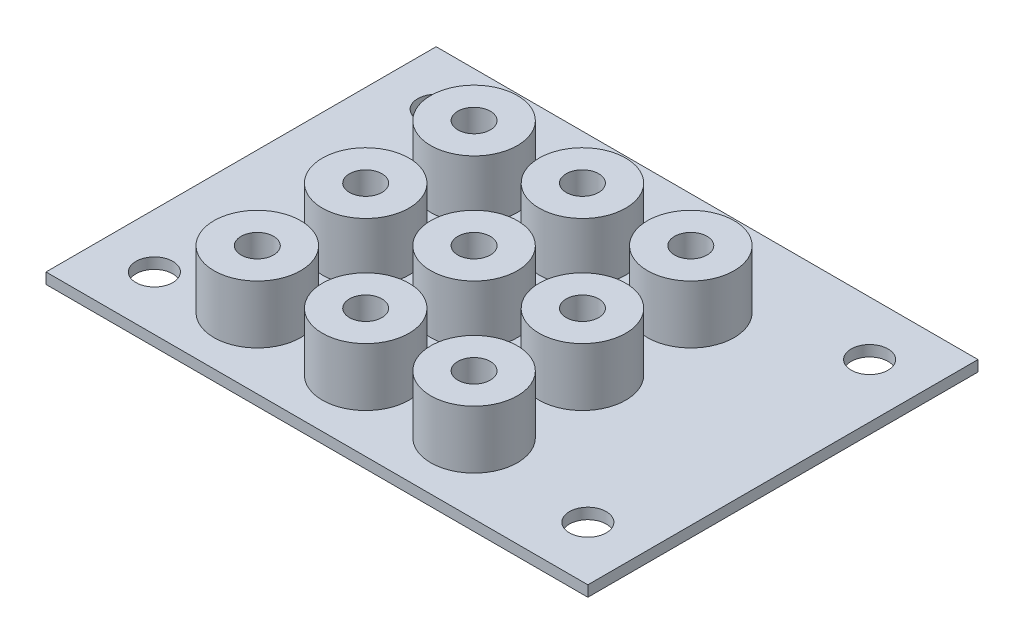
from build123d import *

# Parameters (mm, degrees)
SKETCH1_W           = 50
SKETCH1_H           = 36
SKETCH1_R           = 1.7
SKETCH1_R_2         = 1.25
BOSS_EXTRUDE1_DEPTH = 1
SKETCH2_R           = 4
SKETCH2_R_2         = 1.5
BOSS_EXTRUDE2_DEPTH = 5.35


with BuildPart() as part:
    # Sketch1 → Boss-Extrude1 (new body)
    with BuildSketch(Plane(origin=(0, 0, 0), x_dir=(1, 0, 0), z_dir=(0, 1, 0))):
        with Locations((25, 18)):
            Rectangle(SKETCH1_W, SKETCH1_H)
        with Locations((5, 5)):
            Circle(SKETCH1_R, mode=Mode.SUBTRACT)
        with Locations((13, 6.5)):
            Circle(SKETCH1_R_2, mode=Mode.SUBTRACT)
        with Locations((23, 6.5)):
            Circle(SKETCH1_R_2, mode=Mode.SUBTRACT)
        with Locations((13, 16.5)):
            Circle(SKETCH1_R_2, mode=Mode.SUBTRACT)
        with Locations((23, 16.5)):
            Circle(SKETCH1_R_2, mode=Mode.SUBTRACT)
        with Locations((33, 6.5)):
            Circle(SKETCH1_R_2, mode=Mode.SUBTRACT)
        with Locations((45, 5)):
            Circle(SKETCH1_R, mode=Mode.SUBTRACT)
        with Locations((33, 16.5)):
            Circle(SKETCH1_R_2, mode=Mode.SUBTRACT)
        with Locations((13, 26.5)):
            Circle(SKETCH1_R_2, mode=Mode.SUBTRACT)
        with Locations((23, 26.5)):
            Circle(SKETCH1_R_2, mode=Mode.SUBTRACT)
        with Locations((5, 31)):
            Circle(SKETCH1_R, mode=Mode.SUBTRACT)
        with Locations((33, 26.5)):
            Circle(SKETCH1_R_2, mode=Mode.SUBTRACT)
        with Locations((45, 31)):
            Circle(SKETCH1_R, mode=Mode.SUBTRACT)
    extrude(amount=BOSS_EXTRUDE1_DEPTH)

    # Sketch2 → Boss-Extrude2 (add)
    # profile 1 of 9: a face of its own
    with BuildSketch(Plane(origin=(0, 1, 0), x_dir=(1, 0, 0), z_dir=(0, 1, 0))):
        with Locations((13, 26.5)):
            Circle(SKETCH2_R)
        with Locations((13, 26.5)):
            Circle(SKETCH2_R_2, mode=Mode.SUBTRACT)
    # profile 2 of 9: a face of its own
    with BuildSketch(Plane(origin=(0, 1, 0), x_dir=(1, 0, 0), z_dir=(0, 1, 0))):
        with Locations((23, 26.5)):
            Circle(SKETCH2_R)
        with Locations((23, 26.5)):
            Circle(SKETCH2_R_2, mode=Mode.SUBTRACT)
    # profile 3 of 9: a face of its own
    with BuildSketch(Plane(origin=(0, 1, 0), x_dir=(1, 0, 0), z_dir=(0, 1, 0))):
        with Locations((33, 26.5)):
            Circle(SKETCH2_R)
        with Locations((33, 26.5)):
            Circle(SKETCH2_R_2, mode=Mode.SUBTRACT)
    # profile 4 of 9: a face of its own
    with BuildSketch(Plane(origin=(0, 1, 0), x_dir=(1, 0, 0), z_dir=(0, 1, 0))):
        with Locations((23, 16.5)):
            Circle(SKETCH2_R)
        with Locations((23, 16.5)):
            Circle(SKETCH2_R_2, mode=Mode.SUBTRACT)
    # profile 5 of 9: a face of its own
    with BuildSketch(Plane(origin=(0, 1, 0), x_dir=(1, 0, 0), z_dir=(0, 1, 0))):
        with Locations((33, 16.5)):
            Circle(SKETCH2_R)
        with Locations((33, 16.5)):
            Circle(SKETCH2_R_2, mode=Mode.SUBTRACT)
    # profile 6 of 9: a face of its own
    with BuildSketch(Plane(origin=(0, 1, 0), x_dir=(1, 0, 0), z_dir=(0, 1, 0))):
        with Locations((23, 6.5)):
            Circle(SKETCH2_R)
        with Locations((23, 6.5)):
            Circle(SKETCH2_R_2, mode=Mode.SUBTRACT)
    # profile 7 of 9: a face of its own
    with BuildSketch(Plane(origin=(0, 1, 0), x_dir=(1, 0, 0), z_dir=(0, 1, 0))):
        with Locations((33, 6.5)):
            Circle(SKETCH2_R)
        with Locations((33, 6.5)):
            Circle(SKETCH2_R_2, mode=Mode.SUBTRACT)
    # profile 8 of 9: a face of its own
    with BuildSketch(Plane(origin=(0, 1, 0), x_dir=(1, 0, 0), z_dir=(0, 1, 0))):
        with Locations((13, 16.5)):
            Circle(SKETCH2_R)
        with Locations((13, 16.5)):
            Circle(SKETCH2_R_2, mode=Mode.SUBTRACT)
    # profile 9 of 9: a face of its own
    with BuildSketch(Plane(origin=(0, 1, 0), x_dir=(1, 0, 0), z_dir=(0, 1, 0))):
        with Locations((13, 6.5)):
            Circle(SKETCH2_R)
        with Locations((13, 6.5)):
            Circle(SKETCH2_R_2, mode=Mode.SUBTRACT)
    extrude(amount=BOSS_EXTRUDE2_DEPTH)


solid = part.part
